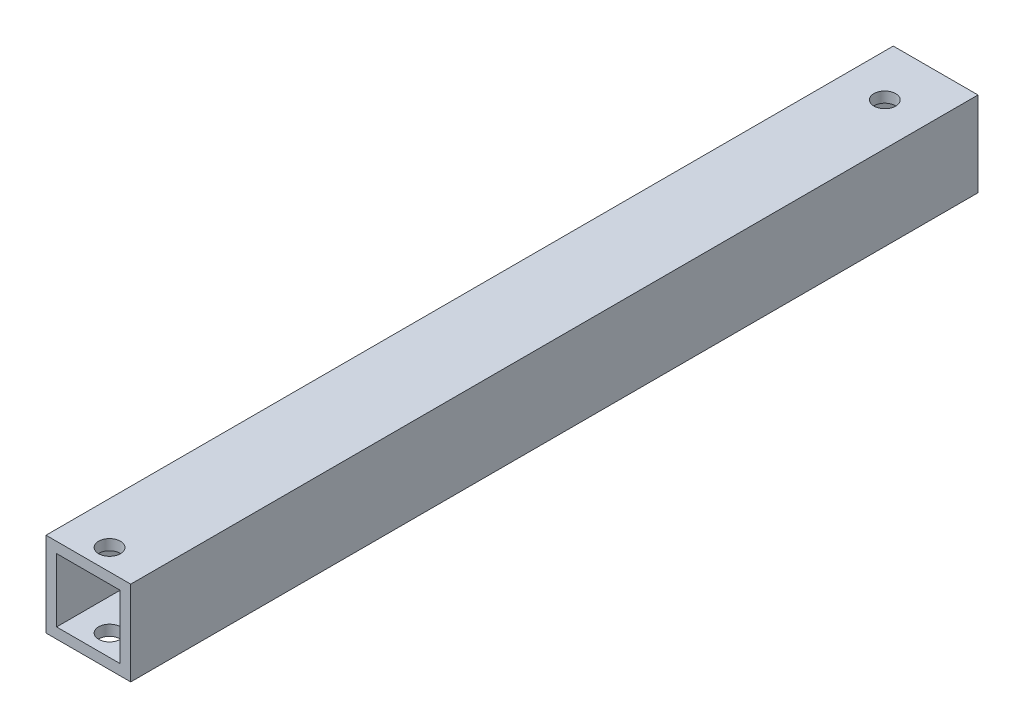
from build123d import *

# Parameters (mm, degrees)
SKETCH2_W           = 25.4
SKETCH2_H           = 25.4
BOSS_EXTRUDE1_DEPTH = 254
SKETCH4_W           = 19.05
SKETCH4_H           = 19.05
CUT_EXTRUDE1_DEPTH  = 255.634208228
SKETCH5_R           = 3.2639
CUT_EXTRUDE2_DEPTH  = 304.8
SKETCH6_R           = 3.2639
CUT_EXTRUDE3_DEPTH  = 256.582569828


with BuildPart() as part:
    # Sketch2 → Boss-Extrude1 (new body)
    with BuildSketch(Plane.XY):
        Rectangle(SKETCH2_W, SKETCH2_H)
    extrude(amount=BOSS_EXTRUDE1_DEPTH)

    # Sketch4 → Cut-Extrude1 (cut, through all)
    with BuildSketch(Plane.XY):
        Rectangle(SKETCH4_W, SKETCH4_H)
    extrude(amount=CUT_EXTRUDE1_DEPTH, mode=Mode.SUBTRACT)

    # Sketch5 → Cut-Extrude2 (cut)
    with BuildSketch(Plane(origin=(0, 12.7, 0), x_dir=(1, 0, 0), z_dir=(0, 1, 0))):
        with Locations((0, -15.24)):
            Circle(SKETCH5_R)
    extrude(amount=-CUT_EXTRUDE2_DEPTH, mode=Mode.SUBTRACT)

    # Sketch6 → Cut-Extrude3 (cut, through all)
    with BuildSketch(Plane(origin=(0, 12.7, 0), x_dir=(1, 0, 0), z_dir=(0, 1, 0))):
        with Locations((0, -247.65)):
            Circle(SKETCH6_R)
    extrude(amount=-CUT_EXTRUDE3_DEPTH, mode=Mode.SUBTRACT)


solid = part.part
